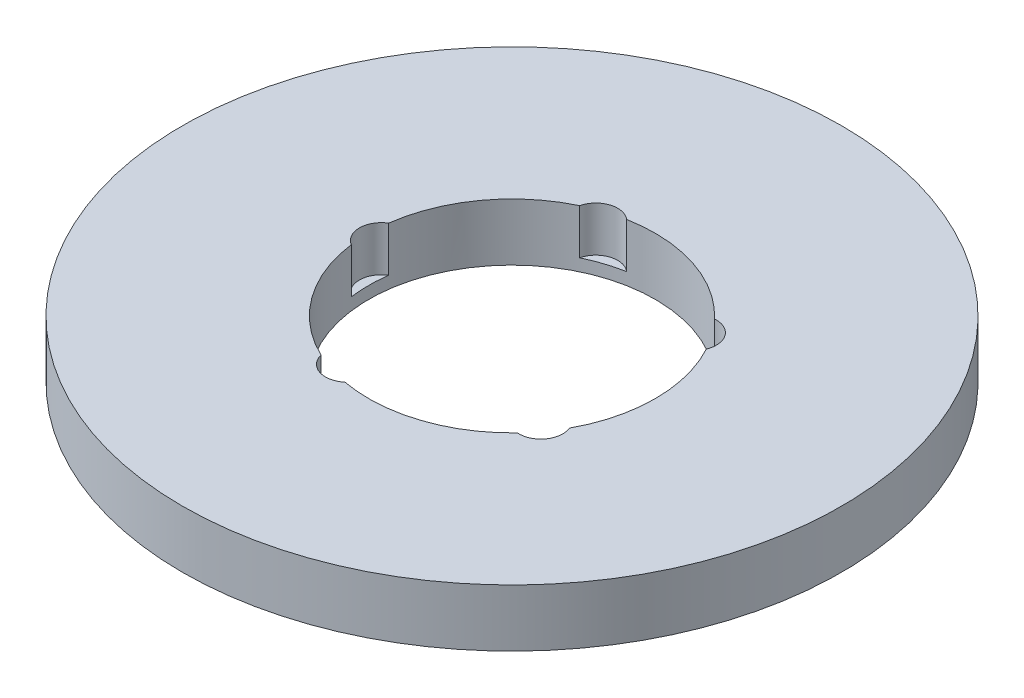
from build123d import *

# Parameters (mm, degrees)
SKETCH1_R           = 57.5
BOSS_EXTRUDE1_DEPTH = 10
SKETCH2_R           = 25
CUT_EXTRUDE1_DEPTH  = 82.929848041
SKETCH3_R           = 3.808721346
CUT_EXTRUDE2_DEPTH  = 7.879265047
CIRPATTERN1_COUNT   = 5


with BuildPart() as part:
    # Sketch1 → Boss-Extrude1 (new body)
    with BuildSketch(Plane(origin=(0, 0, 0), x_dir=(1, 0, 0), z_dir=(0, 1, 0))):
        Circle(SKETCH1_R)
    extrude(amount=BOSS_EXTRUDE1_DEPTH)

    # Sketch2 → Cut-Extrude1 (cut, through all)
    with BuildSketch(Plane(origin=(0, 0, 0), x_dir=(1, 0, 0), z_dir=(0, 1, 0))):
        Circle(SKETCH2_R)
    extrude(amount=CUT_EXTRUDE1_DEPTH, mode=Mode.SUBTRACT)

    # Sketch3 → Cut-Extrude2 (cut)
    with BuildSketch(Plane(origin=(0, 10, 0), x_dir=(1, 0, 0), z_dir=(0, 1, 0))):
        with Locations((-22.802257302, 0)):
            Circle(SKETCH3_R)
    cut_extrude2 = extrude(amount=-CUT_EXTRUDE2_DEPTH, mode=Mode.SUBTRACT)

    # CirPattern1: Cut-Extrude2 ×5 about axis
    cirpattern1_axis = Axis((0, 0, 0), (0, 1, 0))
    for i in range(1, CIRPATTERN1_COUNT):
        add(cut_extrude2.rotate(cirpattern1_axis, i * 360 / CIRPATTERN1_COUNT), mode=Mode.SUBTRACT)


solid = part.part
